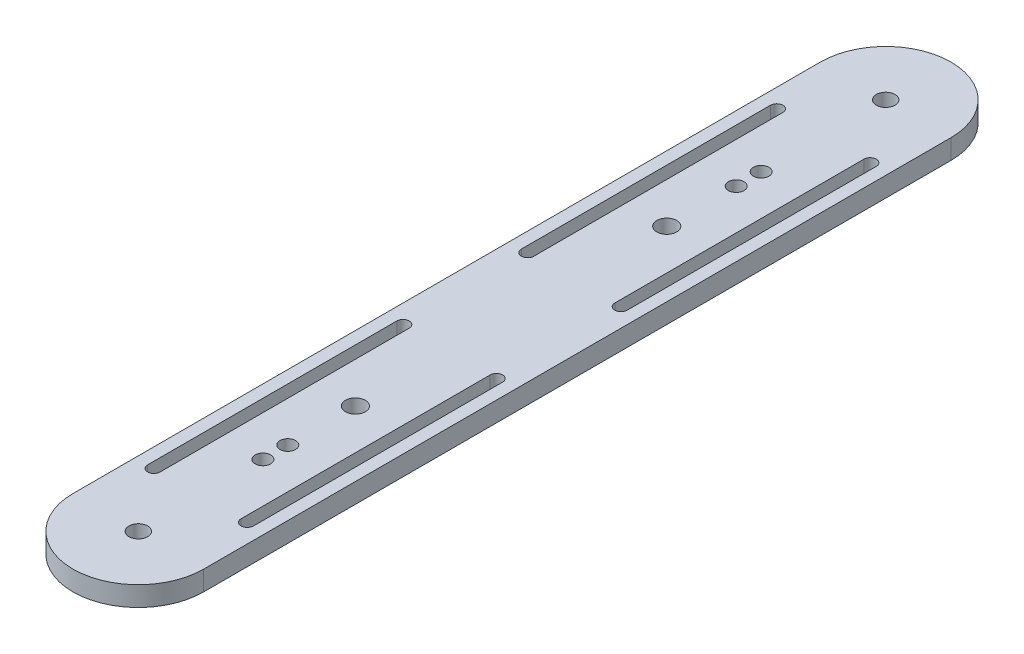
from build123d import *

# Parameters (mm, degrees)
SKETCH1_R               = 1.5
BOSS_EXTRUDE1_DEPTH     = 3.175
CUT_EXTRUDE1_DEPTH      = 131.960225355
CUT_EXTRUDE1_DEPTH_BACK = 131.960225355
CUT_EXTRUDE2_DEPTH      = 131.960225355
CUT_EXTRUDE2_DEPTH_BACK = 131.960225355
CUT_EXTRUDE3_DEPTH      = 131.960225355
CUT_EXTRUDE3_DEPTH_BACK = 131.960225355
SKETCH4_R               = 1.6
CUT_EXTRUDE4_DEPTH      = 40


with BuildPart() as part:
    # Sketch1 → Boss-Extrude1 (new body)
    with BuildSketch(Plane(origin=(0, 0, 0), x_dir=(1, 0, 0), z_dir=(0, 1, 0))):
        with BuildLine():
            Line((-10.5, 0), (-10.5, -120))
            ThreePointArc((-10.5, -120), (0, -130.5), (10.5, -120))
            Line((10.5, -120), (10.5, 0))
            ThreePointArc((10.5, 0), (0, 10.5), (-10.5, 0))
        make_face()
        Circle(SKETCH1_R, mode=Mode.SUBTRACT)
        with Locations((0, -120)):
            Circle(SKETCH1_R, mode=Mode.SUBTRACT)
    extrude(amount=BOSS_EXTRUDE1_DEPTH)

    # Sketch2 → Cut-Extrude1 (cut, two sides: drawn at the far end of the back side and taken through both)
    with BuildSketch(Plane.XZ.offset(-CUT_EXTRUDE1_DEPTH_BACK)):
        with BuildLine():
            ThreePointArc((0, 18.75), (1.25, 20), (0, 21.25))
            ThreePointArc((0, 21.25), (-1.25, 20), (0, 18.75))
        make_face()
        with BuildLine():
            ThreePointArc((0, 25.25), (-1.25, 24), (0, 22.75))
            ThreePointArc((0, 22.75), (1.25, 24), (0, 25.25))
        make_face()
    extrude(amount=CUT_EXTRUDE1_DEPTH + CUT_EXTRUDE1_DEPTH_BACK, mode=Mode.SUBTRACT)

    # Sketch3 → Cut-Extrude2 (cut, two sides: drawn at the far end of the back side and taken through both)
    with BuildSketch(Plane(origin=(0, 3.175, 0), x_dir=(1, 0, 0), z_dir=(0, 1, 0)).offset(-CUT_EXTRUDE2_DEPTH_BACK)):
        with BuildLine():
            ThreePointArc((0, -97.25), (1.25, -96), (0, -94.75))
            ThreePointArc((0, -94.75), (-1.25, -96), (0, -97.25))
        make_face()
        with BuildLine():
            ThreePointArc((0, -98.75), (-1.25, -100), (0, -101.25))
            ThreePointArc((0, -101.25), (1.25, -100), (0, -98.75))
        make_face()
    extrude(amount=CUT_EXTRUDE2_DEPTH + CUT_EXTRUDE2_DEPTH_BACK, mode=Mode.SUBTRACT)

    # Sketch4 → Cut-Extrude3 (cut, two sides: drawn at the far end of the back side and taken through both)
    with BuildSketch(Plane(origin=(0, 3.175, 0), x_dir=(1, 0, 0), z_dir=(0, 1, 0)).offset(-CUT_EXTRUDE3_DEPTH_BACK)):
        with Locations((0, -35.15)):
            Circle(SKETCH4_R)
        with Locations((0, -85.15)):
            Circle(SKETCH4_R)
    extrude(amount=CUT_EXTRUDE3_DEPTH + CUT_EXTRUDE3_DEPTH_BACK, mode=Mode.SUBTRACT)

    # Sketch5 → Cut-Extrude4 (cut)
    with BuildSketch(Plane.XZ):
        with BuildLine():
            Line((-8.5, 10), (-8.5, 50))
            ThreePointArc((-8.5, 50), (-7.5, 51), (-6.5, 50))
            Line((-6.5, 50), (-6.5, 10))
            ThreePointArc((-6.5, 10), (-7.5, 9), (-8.5, 10))
        make_face()
        with BuildLine():
            Line((6.5, 50), (6.5, 10))
            ThreePointArc((6.5, 10), (7.5, 9), (8.5, 10))
            Line((8.5, 10), (8.5, 50))
            ThreePointArc((8.5, 50), (7.5, 51), (6.5, 50))
        make_face()
        with BuildLine():
            Line((8.5, 110), (8.5, 70))
            ThreePointArc((8.5, 70), (7.5, 69), (6.5, 70))
            Line((6.5, 70), (6.5, 110))
            ThreePointArc((6.5, 110), (7.5, 111), (8.5, 110))
        make_face()
        with BuildLine():
            Line((-6.5, 70), (-6.5, 110))
            ThreePointArc((-6.5, 110), (-7.5, 111), (-8.5, 110))
            Line((-8.5, 110), (-8.5, 70))
            ThreePointArc((-8.5, 70), (-7.5, 69), (-6.5, 70))
        make_face()
    extrude(amount=-CUT_EXTRUDE4_DEPTH, mode=Mode.SUBTRACT)


solid = part.part
